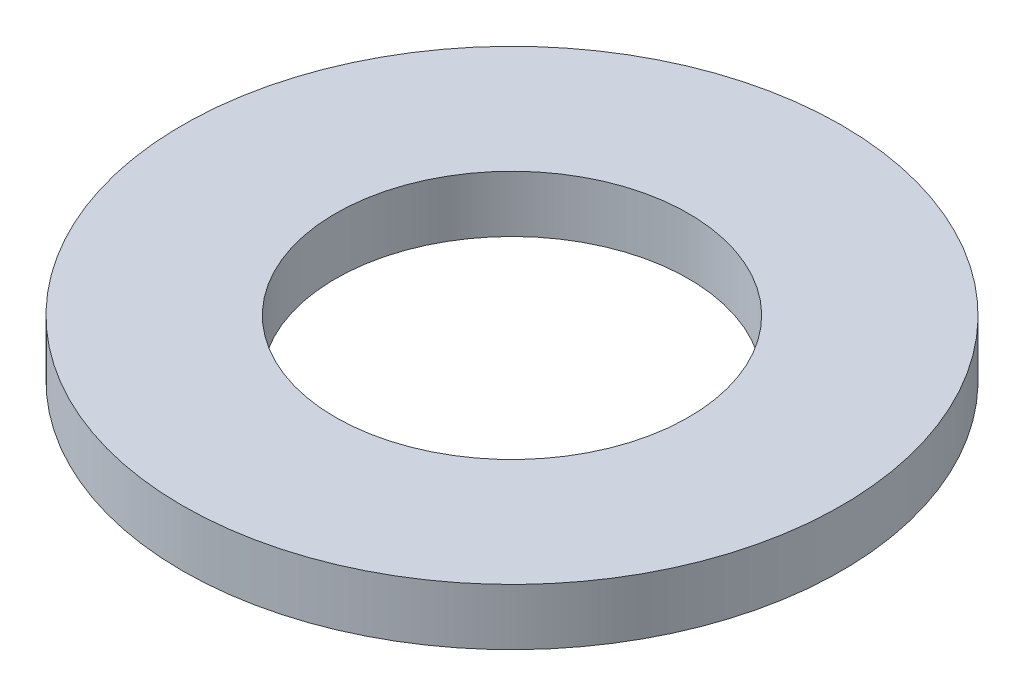
from build123d import *

# Parameters (mm, degrees)
SKETCH1_R           = 70
BOSS_EXTRUDE1_DEPTH = 12
SKETCH2_R           = 37.5
CUT_EXTRUDE1_DEPTH  = 100.719606899


with BuildPart() as part:
    # Sketch1 → Boss-Extrude1 (new body)
    with BuildSketch(Plane(origin=(0, 0, 0), x_dir=(1, 0, 0), z_dir=(0, 1, 0))):
        Circle(SKETCH1_R)
    extrude(amount=BOSS_EXTRUDE1_DEPTH)

    # Sketch2 → Cut-Extrude1 (cut, through all)
    with BuildSketch(Plane(origin=(0, 0, 0), x_dir=(1, 0, 0), z_dir=(0, 1, 0))):
        Circle(SKETCH2_R)
    extrude(amount=CUT_EXTRUDE1_DEPTH, mode=Mode.SUBTRACT)


solid = part.part
